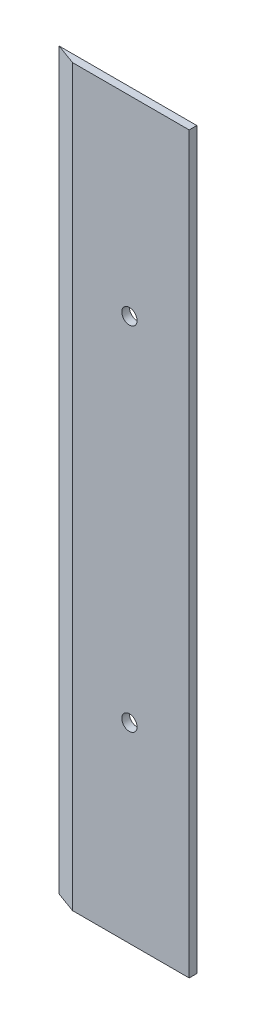
from build123d import *

# Parameters (mm, degrees)
SKETCH_1_W          = 18
SKETCH_1_H          = 96
SKETCH_1_R          = 1
EXTRUDE_1_DEPTH     = 1
CUT_EXTRUDE_1_DEPTH = 117.756631965


with BuildPart() as part:
    # Эскиз1 → Бобышка-Вытянуть1 (new body)
    with BuildSketch(Plane.XY):
        with Locations((-57.446302439, 0)):
            Rectangle(SKETCH_1_W, SKETCH_1_H)
        with Locations((-56.263201647, -23)):
            Circle(SKETCH_1_R, mode=Mode.SUBTRACT)
        with Locations((-56.263201647, 23)):
            Circle(SKETCH_1_R, mode=Mode.SUBTRACT)
    extrude(amount=EXTRUDE_1_DEPTH)

    # Эскиз2 → Вырез-Вытянуть1 (cut, through all)
    with BuildSketch(Plane(origin=(0, 48, 0), x_dir=(1, 0, 0), z_dir=(0, 1, 0))):
        Polygon((-66.446302439, 0), (-63.698825019, -1), (-66.446302439, -1), align=None)
    extrude(amount=-CUT_EXTRUDE_1_DEPTH, mode=Mode.SUBTRACT)


solid = part.part
